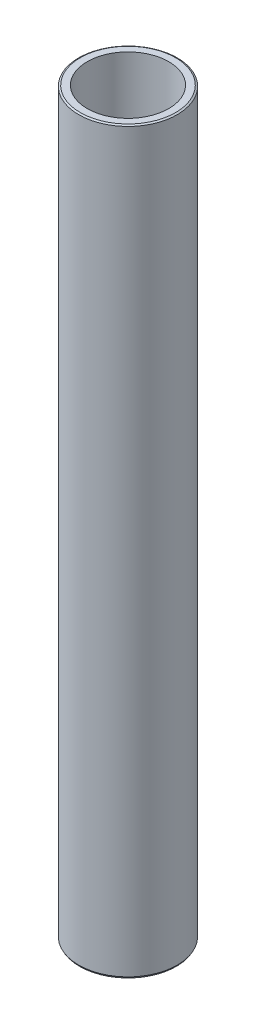
from build123d import *
from OCP.BRepFilletAPI import BRepFilletAPI_MakeChamfer

# Parameters (mm, degrees)
SKETCH1_R           = 40
BOSS_EXTRUDE1_DEPTH = 600
SKETCH2_R           = 33.072657873
CUT_EXTRUDE1_DEPTH  = 603.660766933
CHAMFER1_SIZE       = 0.776256823
CHAMFER1_SIZE2      = 1.344516257


with BuildPart() as part:
    # Sketch1 → Boss-Extrude1 (new body)
    with BuildSketch(Plane(origin=(0, 0, 0), x_dir=(1, 0, 0), z_dir=(0, 1, 0))):
        Circle(SKETCH1_R)
    extrude(amount=BOSS_EXTRUDE1_DEPTH)

    # Sketch2 → Cut-Extrude1 (cut, through all)
    with BuildSketch(Plane(origin=(0, 0, 0), x_dir=(1, 0, 0), z_dir=(0, 1, 0))):
        Circle(SKETCH2_R)
    extrude(amount=CUT_EXTRUDE1_DEPTH, mode=Mode.SUBTRACT)

    # Chamfer1: one chamfer whose edges measure the first distance from different faces: ONE call of the kernel's chamfer builder (chamfer() names one face for all edges)
    chamfer1_edges_1 = [part.edges().sort_by_distance(p)[0] for p in [
        (-40, 600, 0),
    ]]
    chamfer1_side_1 = [part.faces().sort_by_distance(p)[0] for p in [
        (-40, 300, 0),
    ]]
    chamfer1_edges_2 = [part.edges().sort_by_distance(p)[0] for p in [
        (-40, 0, 0),
    ]]
    chamfer1_side_2 = [part.faces().sort_by_distance(p)[0] for p in [
        (-38.86862915, 0, 0),
    ]]
    chamfer1 = BRepFilletAPI_MakeChamfer(part.part.solid().wrapped)
    for e in chamfer1_edges_1:
        chamfer1.Add(CHAMFER1_SIZE, CHAMFER1_SIZE2, e.wrapped, chamfer1_side_1[0].wrapped)  # the first distance lies on this face
    for e in chamfer1_edges_2:
        chamfer1.Add(CHAMFER1_SIZE, CHAMFER1_SIZE2, e.wrapped, chamfer1_side_2[0].wrapped)  # the first distance lies on this face
    add(Compound.cast(chamfer1.Shape()), mode=Mode.REPLACE)


solid = part.part
